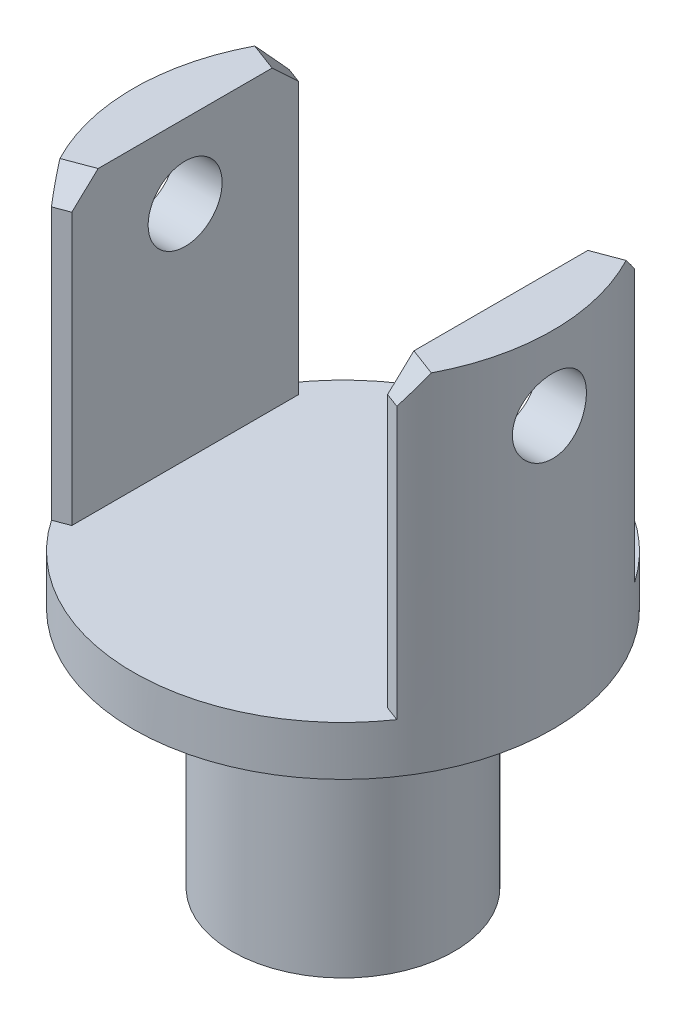
from build123d import *

# Parameters (mm, degrees)
SKETCH1_R           = 42.5
BOSS_EXTRUDE1_DEPTH = 10
BOSS_EXTRUDE2_DEPTH = 60
SKETCH3_R           = 7.5
CUT_EXTRUDE1_DEPTH  = 111.709078219
SKETCH4_R           = 22.5
BOSS_EXTRUDE3_DEPTH = 49
CHAMFER1_SIZE       = 5
CHAMFER2_SIZE       = 5


with BuildPart() as part:
    # Sketch1 → Boss-Extrude1 (new body)
    with BuildSketch(Plane(origin=(0, 0, 0), x_dir=(1, 0, 0), z_dir=(0, 1, 0))):
        with Locations(Location((0, 0, 0), (0, 0, 270))):
            Circle(SKETCH1_R)
    extrude(amount=BOSS_EXTRUDE1_DEPTH)

    # Sketch2 → Boss-Extrude2 (add)
    with BuildSketch(Plane(origin=(0, 10, 0), x_dir=(1, 0, 0), z_dir=(0, 1, 0))):
        with BuildLine():
            Line((32, 27.968732542), (32, -27.968732542))
            ThreePointArc((32, -27.968732542), (42.5, 0), (32, 27.968732542))
        make_face()
    boss_extrude2 = extrude(amount=BOSS_EXTRUDE2_DEPTH)

    # Sketch3 → Cut-Extrude1 (cut, through all)
    with BuildSketch(Plane.ZY.offset(-32)):
        with Locations((0, 55)):
            Circle(SKETCH3_R)
    cut_extrude1 = extrude(amount=-CUT_EXTRUDE1_DEPTH, mode=Mode.SUBTRACT)

    # Mirror1: Boss-Extrude2, Cut-Extrude1 across plane
    add(boss_extrude2.mirror(Plane(origin=(0, 0, 0), x_dir=(0, 0, 1), z_dir=(1, 0, 0))))
    add(cut_extrude1.mirror(Plane(origin=(0, 0, 0), x_dir=(0, 0, 1), z_dir=(1, 0, 0))), mode=Mode.SUBTRACT)

    # Sketch4 → Boss-Extrude3 (add)
    with BuildSketch(Plane.XZ):
        with Locations(Location((0, 0, 0), (0, 0, 90))):
            Circle(SKETCH4_R)
    extrude(amount=BOSS_EXTRUDE3_DEPTH)

    # Chamfer1
    # the kernel refuses this chamfer: 5 mm, written as the material it takes off along each edge
    with BuildSketch(Plane(origin=(32, 10, -27.968732542), x_dir=(0.613569743675552, 0, 0.7896405319168447), z_dir=(0, 1, 0)), Plane(origin=(-32, 10, 27.968732542), x_dir=(-0.613569743675558, 0, -0.78964053191684), z_dir=(0, 1, 0))) as chamfer1_piece_1:
        with BuildLine():
            Line((4.902026088, 0), (CHAMFER1_SIZE * 0.789640531917, -CHAMFER1_SIZE * 0.613569743676))
            Line((CHAMFER1_SIZE * 0.789640531917, -CHAMFER1_SIZE * 0.613569743676), (0, 0))
            ThreePointArc((0, 0), (2.480684858, 0.070724564), (4.902026088, 0))
        make_face()
    extrude(amount=72.684374005, mode=Mode.SUBTRACT)
    with BuildSketch(Plane(origin=(32, 10, 27.968732542), x_dir=(0.6135697436755528, 0, -0.7896405319168441), z_dir=(0, 1, 0)), Plane(origin=(-32, 10, -27.968732542), x_dir=(-0.6135697436755566, 0, 0.7896405319168412), z_dir=(0, 1, 0))) as chamfer1_piece_2:
        with BuildLine():
            Line((4.902026088, 0), (CHAMFER1_SIZE * 0.789640531917, CHAMFER1_SIZE * 0.613569743676))
            Line((CHAMFER1_SIZE * 0.789640531917, CHAMFER1_SIZE * 0.613569743676), (0, 0))
            ThreePointArc((0, 0), (2.480684858, -0.070724564), (4.902026088, 0))
        make_face()
    extrude(amount=72.684374005, mode=Mode.SUBTRACT)

    # Chamfer2
    chamfer2_edges = [part.edges().sort_by_distance(p)[0] for p in [
        (33.503867445, 70, -23.533313298),
        (33.503867445, 70, 23.533313298),
        (-33.503867445, 70, 23.533313298),
        (-33.503867445, 70, -23.533313298),
    ]]
    chamfer(chamfer2_edges, length=CHAMFER2_SIZE)


solid = part.part
